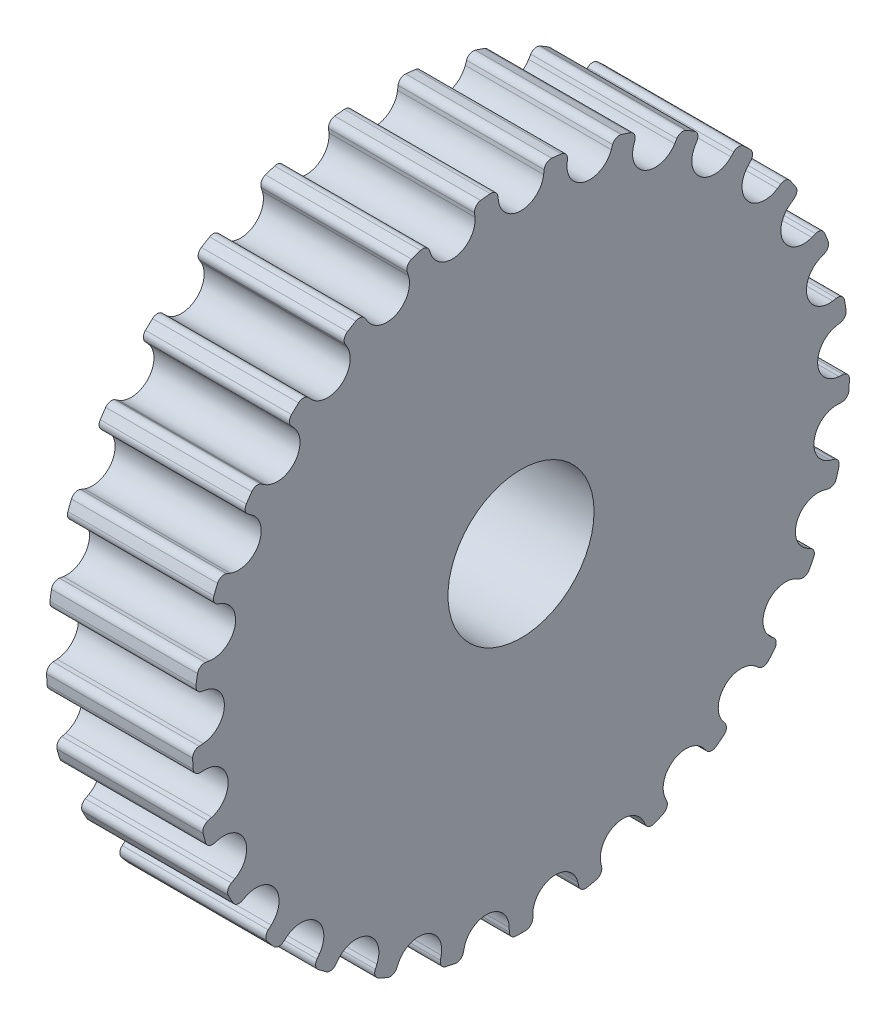
from build123d import *

# Parameters (mm, degrees)
CHAMFER_1_SIZE           = 1
SKETCH_4_W               = 3
SKETCH_4_H               = 1.399999976
CUT_EXTRUDE_1_DEPTH      = 128.050265749
FILLET_1_R               = 2
FILLET_2_R               = 2.5
SKETCH_5_R               = 2.70036
CUT_EXTRUDE_2_DEPTH      = 128.050265749
PATTERN_CIRCULAR_1_COUNT = 4
CUT_EXTRUDE_3_REACH      = 129.05
PATTERN_CIRCULAR_3_COUNT = 29
SKETCH_7_R               = 28.265978088
CUT_EXTRUDE_4_DEPTH      = 56.5
SKETCH_8_R               = 17.347804127
EXTRUDE_1_DEPTH          = 10
SKETCH_9_R               = 5
CUT_EXTRUDE_5_DEPTH      = 10


with BuildPart() as part:
    # 草图1 → 旋转1 (revolve)
    with BuildSketch(Plane.XY, mode=Mode.PRIVATE) as revolve_1_sk:
        with BuildLine():
            Line((0, 4.5006), (0, 9.0012))
            Line((0, 9.0012), (44, 10.760730772))
            Line((44, 10.760730772), (44, 16.242869228))
            Line((44, 16.242869228), (0, 18.0024))
            Line((0, 18.0024), (0, 22.303))
            ThreePointArc((0, 22.303), (0.058578644, 22.444421356), (0.2, 22.503))
            Line((0.2, 22.503), (122.8, 22.503))
            ThreePointArc((122.8, 22.503), (122.941421356, 22.444421356), (123, 22.303))
            Line((123, 22.303), (123, 18.0024))
            Line((123, 18.0024), (79, 16.242869228))
            Line((79, 16.242869228), (79, 10.760730772))
            Line((79, 10.760730772), (123, 9.0012))
            Line((123, 9.0012), (123, 4.5006))
            Line((123, 4.5006), (0, 4.5006))
        make_face()
    revolve(revolve_1_sk.sketch.rotate(Axis((0, 0, 0), (1, 0, 0)), 90), axis=Axis((0, 0, 0), (1, 0, 0)))

    # 倒角1
    chamfer_1_edges = [part.edges().sort_by_distance(p)[0] for p in [
        (0, 0, -4.5006),
        (123, 0, -4.5006),
    ]]
    chamfer(chamfer_1_edges, length=CHAMFER_1_SIZE)

    # 草图4 → 切除-拉伸1 (cut, through all)
    with BuildSketch(Plane.ZY):
        with Locations((0, 4.943277066)):
            Rectangle(SKETCH_4_W, SKETCH_4_H)
    extrude(amount=-CUT_EXTRUDE_1_DEPTH, mode=Mode.SUBTRACT)

    # 圆角1
    fillet_1_edges = [part.edges().sort_by_distance(p)[0] for p in [
        (79, 0, -10.760730772),
        (79, 0, -16.242869228),
        (44, 0, -16.242869228),
        (44, 0, -10.760730772),
    ]]
    fillet(fillet_1_edges, radius=FILLET_1_R)

    # 圆角2
    fillet_2_edges = [part.edges().sort_by_distance(p)[0] for p in [
        (0, 0, -9.0012),
        (123, 0, -9.0012),
    ]]
    fillet(fillet_2_edges, radius=FILLET_2_R)

    # 草图5 → 切除-拉伸2 (cut, through all)
    with BuildSketch(Plane(origin=(0, 0, 0), x_dir=(0, 0, -1), z_dir=(1, 0, 0))):
        with Locations(Location((0, 13.5018, 0), (0, 0, 167.721246106))):
            Circle(SKETCH_5_R)
    cut_extrude_2 = extrude(amount=CUT_EXTRUDE_2_DEPTH, mode=Mode.SUBTRACT)

    # 阵列(圆周)1: 切除-拉伸2 ×4 about axis
    pattern_circular_1_axis = Axis((0, 0, 0), (1, 0, 0))
    for i in range(1, PATTERN_CIRCULAR_1_COUNT):
        add(cut_extrude_2.rotate(pattern_circular_1_axis, i * 360 / PATTERN_CIRCULAR_1_COUNT), mode=Mode.SUBTRACT)

    # 草图6 → 切除-拉伸3 (cut, up to next)
    with BuildSketch(Plane(origin=(0, 0, 0), x_dir=(0, 0, -1), z_dir=(1, 0, 0)), mode=Mode.PRIVATE) as cut_extrude_3_sk1:
        with BuildLine():
            Line((-1.581796938, 21.98510813), (-1.548371997, 21.712883824))
            ThreePointArc((-1.548371997, 21.712883824), (0, 20.343), (1.548371997, 21.712883824))
            Line((1.548371997, 21.712883824), (1.581796938, 21.98510813))
            ThreePointArc((1.581796938, 21.98510813), (1.757327049, 22.300594774), (2.103078791, 22.404510006))
            ThreePointArc((2.103078791, 22.404510006), (2.341904232, 22.380806365), (2.58046329, 22.35455699))
            Line((2.58046329, 22.35455699), (7.030535869, 58.597489701))
            ThreePointArc((7.030535869, 58.597489701), (0, 59.017745076), (-7.030535869, 58.597489701))
            Line((-7.030535869, 58.597489701), (-2.58046329, 22.35455699))
            ThreePointArc((-2.58046329, 22.35455699), (-2.341904232, 22.380806365), (-2.103078791, 22.404510006))
            ThreePointArc((-2.103078791, 22.404510006), (-1.757327049, 22.300594774), (-1.581796938, 21.98510813))
        make_face()
    cut_extrude_3_tool1 = extrude(cut_extrude_3_sk1.sketch, amount=CUT_EXTRUDE_3_REACH, mode=Mode.PRIVATE) & part.part
    cut_extrude_3 = cut_extrude_3_tool1.solids().sort_by_distance((0, 43.122626, 0))[0]
    add(cut_extrude_3, mode=Mode.SUBTRACT)

    # 阵列(圆周)3: 切除-拉伸3 ×29 about axis
    pattern_circular_3_axis = Axis((0, 0, 0), (1, 0, 0))
    for i in range(1, PATTERN_CIRCULAR_3_COUNT):
        add(cut_extrude_3.rotate(pattern_circular_3_axis, i * 360 / PATTERN_CIRCULAR_3_COUNT), mode=Mode.SUBTRACT)

    # 草图7 → 切除-拉伸4 (cut)
    with BuildSketch(Plane(origin=(123, 0, 0), x_dir=(0, 0, -1), z_dir=(1, 0, 0))):
        Circle(SKETCH_7_R)
    cut_extrude_4 = extrude(amount=-CUT_EXTRUDE_4_DEPTH, mode=Mode.SUBTRACT)

    # 镜向1: 切除-拉伸4 across plane
    add(cut_extrude_4.mirror(Plane(origin=(61.5, 0, 0), x_dir=(0, 0, 1), z_dir=(1, 0, 0))), mode=Mode.SUBTRACT)

    # 草图8 → 凸台-拉伸1 (add)
    with BuildSketch(Plane(origin=(66.5, 0, 0), x_dir=(0, 0, -1), z_dir=(1, 0, 0))):
        Circle(SKETCH_8_R)
    extrude(amount=-EXTRUDE_1_DEPTH)

    # 草图9 → 切除-拉伸5 (cut)
    with BuildSketch(Plane(origin=(66.5, 0, 0), x_dir=(0, 0, -1), z_dir=(1, 0, 0))):
        Circle(SKETCH_9_R)
    extrude(amount=-CUT_EXTRUDE_5_DEPTH, mode=Mode.SUBTRACT)


solid = part.part
